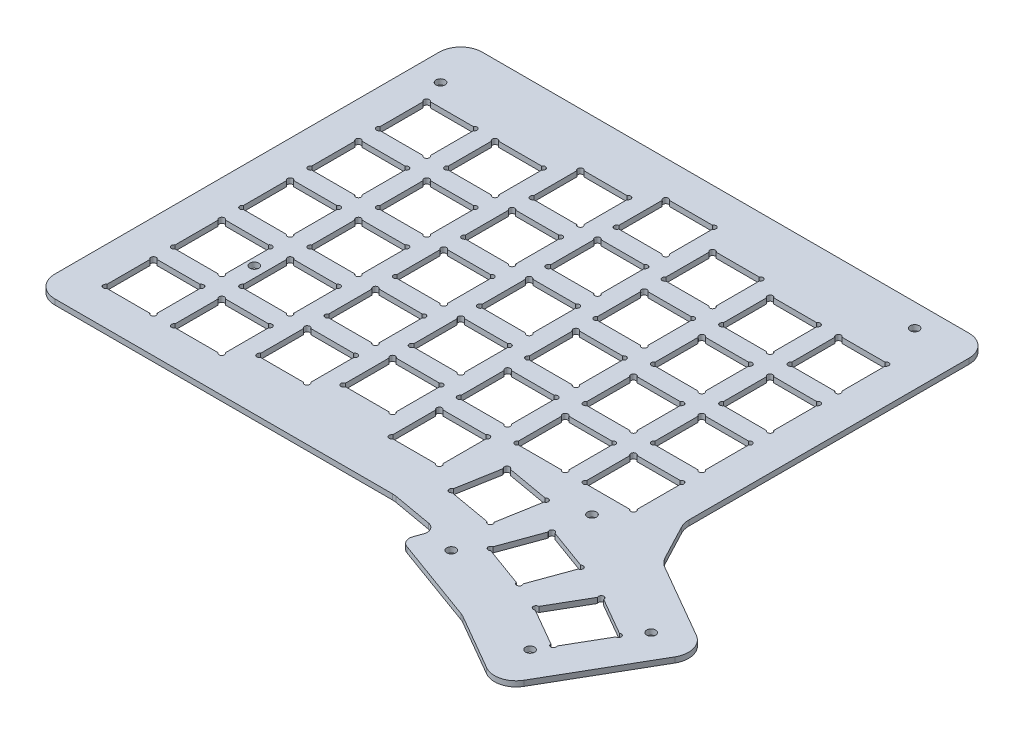
from build123d import *

# Parameters (mm, degrees)
BOSS_EXTRUDE1_DEPTH = 1.5
CUT_EXTRUDE1_DEPTH  = 10
SKETCH3_R           = 0.75
SKETCH3_W           = 14.000106753
SKETCH3_H           = 14.000106753
CUT_EXTRUDE2_DEPTH  = 10
CUT_EXTRUDE3_DEPTH  = 10
CUT_EXTRUDE4_DEPTH  = 10
SKETCH6_R           = 0.75
SKETCH6_W           = 14.000106753
SKETCH6_H           = 14.000106753
CUT_EXTRUDE5_DEPTH  = 10
SKETCH7_R           = 0.75
SKETCH7_W           = 14.000106753
SKETCH7_H           = 14.000106753
CUT_EXTRUDE6_DEPTH  = 10
CUT_EXTRUDE7_DEPTH  = 10
LPATTERN1_COUNT     = 5
LPATTERN1_PITCH     = 19.05
LPATTERN2_COUNT     = 4
LPATTERN2_PITCH     = 19.05
SKETCH10_R          = 0.75
CUT_EXTRUDE8_DEPTH  = 10
SKETCH11_R          = 0.75
CUT_EXTRUDE10_DEPTH = 10
SKETCH12_R          = 0.75
CUT_EXTRUDE11_DEPTH = 10
FILLET5_R           = 6
FILLET6_R           = 2.5
SKETCH50_R          = 1.25
CUT_EXTRUDE18_DEPTH = 10


with BuildPart() as part:
    # Sketch1 → Boss-Extrude1 (new body)
    with BuildSketch(Plane(origin=(0, 0, 0), x_dir=(1, 0, 0), z_dir=(0, 1, 0))):
        Polygon((-119.749113247, 121.951327297), (28.050882345, 121.951327297), (28.050882345, 36.386945552), (34.66034739, 23.828773594), (62.179517595, 7.940573269), (40.773379565, -29.135945393), (19.414491964, -16.804385888), (-7.217003795, -7.111314137), (-4.556726455, 0.197737784), (-19.038852238, 2.751327297), (-119.749113247, 2.751327297), align=None)
    extrude(amount=-BOSS_EXTRUDE1_DEPTH)

    # Sketch2 → Cut-Extrude1 (cut)
    with BuildSketch(Plane(origin=(0, 0, 0), x_dir=(1, 0, 0), z_dir=(0, 1, 0))):
        with BuildLine():
            ThreePointArc((-51.846122029, 112.251327297), (-53.037889943, 112.428103993), (-52.861113247, 111.236336079))
            Line((-52.861113247, 111.236336079), (-52.861113247, 99.15697298))
            ThreePointArc((-52.861113247, 99.15697298), (-53.214666638, 97.897773907), (-51.955467565, 98.251327297))
            Line((-51.955467565, 98.251327297), (-39.876104466, 98.251327297))
            ThreePointArc((-39.876104466, 98.251327297), (-38.684336552, 98.074550602), (-38.861113247, 99.266318516))
            Line((-38.861113247, 99.266318516), (-38.861113247, 111.236336079))
            ThreePointArc((-38.861113247, 111.236336079), (-38.684336552, 112.428103993), (-39.876104466, 112.251327297))
            Line((-39.876104466, 112.251327297), (-51.846122029, 112.251327297))
        make_face()
    cut_extrude1 = extrude(amount=-CUT_EXTRUDE1_DEPTH, mode=Mode.SUBTRACT)

    # Sketch3 → Cut-Extrude2 (cut)
    with BuildSketch(Plane(origin=(0, 0, 0), x_dir=(1, 0, 0), z_dir=(0, 1, 0))):
        with Locations((-58.264613261, 107.135273907)):
            Circle(SKETCH3_R)
        with Locations((-71.557613234, 107.135273907)):
            Circle(SKETCH3_R)
        with Locations((-71.557613234, 93.842273934)):
            Circle(SKETCH3_R)
        with Locations((-58.264613261, 93.842273934)):
            Circle(SKETCH3_R)
        with Locations((-64.911113247, 100.48877392)):
            Rectangle(SKETCH3_W, SKETCH3_H)
    cut_extrude2 = extrude(amount=-CUT_EXTRUDE2_DEPTH, mode=Mode.SUBTRACT)

    # Sketch4 → Cut-Extrude3 (cut)
    with BuildSketch(Plane(origin=(0, 0, 0), x_dir=(1, 0, 0), z_dir=(0, 1, 0))):
        with BuildLine():
            ThreePointArc((-89.946175406, 102.726327297), (-91.13794332, 102.903103993), (-90.961166624, 101.711336079))
            Line((-90.961166624, 101.711336079), (-90.961166624, 89.741211762))
            ThreePointArc((-90.961166624, 89.741211762), (-91.13794332, 88.549443849), (-89.946175406, 88.726220544))
            Line((-89.946175406, 88.726220544), (-77.976051089, 88.726220544))
            ThreePointArc((-77.976051089, 88.726220544), (-76.784283175, 88.549443849), (-76.961059871, 89.741211762))
            Line((-76.961059871, 89.741211762), (-76.961059871, 101.711336079))
            ThreePointArc((-76.961059871, 101.711336079), (-76.784283175, 102.903103993), (-77.976051089, 102.726327297))
            Line((-77.976051089, 102.726327297), (-89.946175406, 102.726327297))
        make_face()
    cut_extrude3 = extrude(amount=-CUT_EXTRUDE3_DEPTH, mode=Mode.SUBTRACT)

    # Sketch5 → Cut-Extrude4 (cut)
    with BuildSketch(Plane(origin=(0, 0, 0), x_dir=(1, 0, 0), z_dir=(0, 1, 0))):
        with BuildLine():
            ThreePointArc((-108.996175406, 102.726327297), (-110.18794332, 102.903103993), (-110.011166624, 101.711336079))
            Line((-110.011166624, 101.711336079), (-110.011166624, 89.741211762))
            ThreePointArc((-110.011166624, 89.741211762), (-110.18794332, 88.549443849), (-108.996175406, 88.726220544))
            Line((-108.996175406, 88.726220544), (-97.026051089, 88.726220544))
            ThreePointArc((-97.026051089, 88.726220544), (-95.834283175, 88.549443849), (-96.011059871, 89.741211762))
            Line((-96.011059871, 89.741211762), (-96.011059871, 101.711336079))
            ThreePointArc((-96.011059871, 101.711336079), (-95.834283175, 102.903103993), (-97.026051089, 102.726327297))
            Line((-97.026051089, 102.726327297), (-108.996175406, 102.726327297))
        make_face()
    cut_extrude4 = extrude(amount=-CUT_EXTRUDE4_DEPTH, mode=Mode.SUBTRACT)

    # Sketch6 → Cut-Extrude5 (cut)
    with BuildSketch(Plane(origin=(0, 0, 0), x_dir=(1, 0, 0), z_dir=(0, 1, 0))):
        with Locations((-33.457559857, 105.897773907)):
            Circle(SKETCH6_R)
        with Locations((-20.164559885, 105.897773907)):
            Circle(SKETCH6_R)
        with Locations((-33.457559857, 92.604773934)):
            Circle(SKETCH6_R)
        with Locations((-20.164559885, 92.604773934)):
            Circle(SKETCH6_R)
        with Locations((-26.811059871, 99.251273921)):
            Rectangle(SKETCH6_W, SKETCH6_H)
    cut_extrude5 = extrude(amount=-CUT_EXTRUDE5_DEPTH, mode=Mode.SUBTRACT)

    # Sketch7 → Cut-Extrude6 (cut)
    with BuildSketch(Plane(origin=(0, 0, 0), x_dir=(1, 0, 0), z_dir=(0, 1, 0))):
        with Locations((-14.407559857, 102.897773907)):
            Circle(SKETCH7_R)
        with Locations((-1.114559885, 102.897773907)):
            Circle(SKETCH7_R)
        with Locations((-1.114559885, 89.604773934)):
            Circle(SKETCH7_R)
        with Locations((-14.407559857, 89.604773934)):
            Circle(SKETCH7_R)
        with Locations((-7.761059871, 96.251273921)):
            Rectangle(SKETCH7_W, SKETCH7_H)
    cut_extrude6 = extrude(amount=-CUT_EXTRUDE6_DEPTH, mode=Mode.SUBTRACT)

    # Sketch8 → Cut-Extrude7 (cut)
    with BuildSketch(Plane(origin=(0, 0, 0), x_dir=(1, 0, 0), z_dir=(0, 1, 0))):
        with BuildLine():
            ThreePointArc((5.303877971, 103.251327297), (4.112110057, 103.428103993), (4.288886753, 102.236336079))
            Line((4.288886753, 102.236336079), (4.288886753, 90.266211762))
            ThreePointArc((4.288886753, 90.266211762), (4.112110057, 89.074443849), (5.303877971, 89.251220544))
            Line((5.303877971, 89.251220544), (17.274002288, 89.251220544))
            ThreePointArc((17.274002288, 89.251220544), (18.465770201, 89.074443849), (18.288993506, 90.266211762))
            Line((18.288993506, 90.266211762), (18.288993506, 102.236336079))
            ThreePointArc((18.288993506, 102.236336079), (18.465770201, 103.428103993), (17.274002288, 103.251327297))
            Line((17.274002288, 103.251327297), (5.303877971, 103.251327297))
        make_face()
    cut_extrude7 = extrude(amount=-CUT_EXTRUDE7_DEPTH, mode=Mode.SUBTRACT)

    # LPattern1: Cut-Extrude1, Cut-Extrude2, Cut-Extrude3, Cut-Extrude4, Cut-Extrude5 ×5
    with Locations(*[(0, 0, i * LPATTERN1_PITCH) for i in range(1, LPATTERN1_COUNT)]):
        add(cut_extrude1, mode=Mode.SUBTRACT)
        add(cut_extrude2, mode=Mode.SUBTRACT)
        add(cut_extrude3, mode=Mode.SUBTRACT)
        add(cut_extrude4, mode=Mode.SUBTRACT)
        add(cut_extrude5, mode=Mode.SUBTRACT)

    # LPattern2: Cut-Extrude6, Cut-Extrude7 ×4
    with Locations(*[(0, 0, i * LPATTERN2_PITCH) for i in range(1, LPATTERN2_COUNT)]):
        add(cut_extrude6, mode=Mode.SUBTRACT)
        add(cut_extrude7, mode=Mode.SUBTRACT)

    # Sketch10 → Cut-Extrude8 (cut)
    with BuildSketch(Plane(origin=(0, 0, 0), x_dir=(1, 0, 0), z_dir=(0, 1, 0))):
        with Locations((-9.776328601, 24.874847872)):
            Circle(SKETCH10_R)
        with Locations((3.314720833, 22.566542651)):
            Circle(SKETCH10_R)
        with Locations((-12.084633822, 11.783798438)):
            Circle(SKETCH10_R)
        with Locations((1.006415612, 9.475493217)):
            Circle(SKETCH10_R)
        Polygon((-10.063116819, 25.284423894), (3.724296855, 22.853330869), (1.29320383, 9.065917195), (-12.494209844, 11.49701022), align=None)
    extrude(amount=-CUT_EXTRUDE8_DEPTH, mode=Mode.SUBTRACT)

    # Sketch11 → Cut-Extrude10 (cut)
    with BuildSketch(Plane(origin=(0, 0, 0), x_dir=(1, 0, 0), z_dir=(0, 1, 0))):
        with Locations((11.891887894, 15.758959139)):
            Circle(SKETCH11_R)
        with Locations((24.383221876, 11.212485383)):
            Circle(SKETCH11_R)
        with Locations((19.836748121, -1.278848599)):
            Circle(SKETCH11_R)
        with Locations((7.345414139, 3.267625157)):
            Circle(SKETCH11_R)
        Polygon((11.680578763, 16.212113032), (24.83637577, 11.423794514), (20.048057252, -1.732002493), (6.892260245, 3.056316026), align=None)
    extrude(amount=-CUT_EXTRUDE10_DEPTH, mode=Mode.SUBTRACT)

    # Sketch12 → Cut-Extrude11 (cut)
    with BuildSketch(Plane(origin=(0, 0, 0), x_dir=(1, 0, 0), z_dir=(0, 1, 0))):
        with Locations((34.634798315, 6.720593948)):
            Circle(SKETCH12_R)
        with Locations((46.146873983, 0.074093961)):
            Circle(SKETCH12_R)
        with Locations((39.500373997, -11.437981707)):
            Circle(SKETCH12_R)
        with Locations((27.988298329, -4.791481721)):
            Circle(SKETCH12_R)
        Polygon((34.505388792, 7.203556861), (46.629836897, 0.203503484), (39.62978352, -11.92094462), (27.505335416, -4.920891243), align=None)
    extrude(amount=-CUT_EXTRUDE11_DEPTH, mode=Mode.SUBTRACT)

    # Fillet5
    fillet5_edges = [part.edges().sort_by_distance(p)[0] for p in [
        (28.050882345, -0.75, -36.386945552),
        (34.66034739, -0.75, -23.828773594),
        (62.179517595, -0.75, -7.940573269),
        (40.773379565, -0.75, 29.135945393),
        (19.414491964, -0.75, 16.804385888),
        (-19.038852238, -0.75, -2.751327297),
        (-119.749113247, -0.75, -2.751327297),
        (-119.749113247, -0.75, -121.951327297),
        (28.050882345, -0.75, -121.951327297),
    ]]
    fillet(fillet5_edges, radius=FILLET5_R)

    # Fillet6
    fillet6_edges = [part.edges().sort_by_distance(p)[0] for p in [
        (-4.556726455, -0.75, -0.197737784),
        (-7.217003795, -0.75, 7.111314137),
    ]]
    fillet(fillet6_edges, radius=FILLET6_R)

    # Sketch50 → Cut-Extrude18 (cut)
    with BuildSketch(Plane(origin=(0, -1.5, 0), x_dir=(-1, 0, 0), z_dir=(0, -1, 0))):
        with Locations((112.249113247, 108.817379297)):
            Circle(SKETCH50_R)
        with Locations((-13.250886753, 115.551327297)):
            Circle(SKETCH50_R)
        with Locations((93.949113247, 38.585275297)):
            Circle(SKETCH50_R)
        with Locations((-13.250886753, 25.551327297)):
            Circle(SKETCH50_R)
        with Locations((-50.016938753, 5.301327297)):
            Circle(SKETCH50_R)
        with Locations((-37.250886753, -15.698672703)):
            Circle(SKETCH50_R)
        with Locations((-2.266938753, -2.698672703)):
            Circle(SKETCH50_R)
    extrude(amount=-CUT_EXTRUDE18_DEPTH, mode=Mode.SUBTRACT)


solid = part.part
